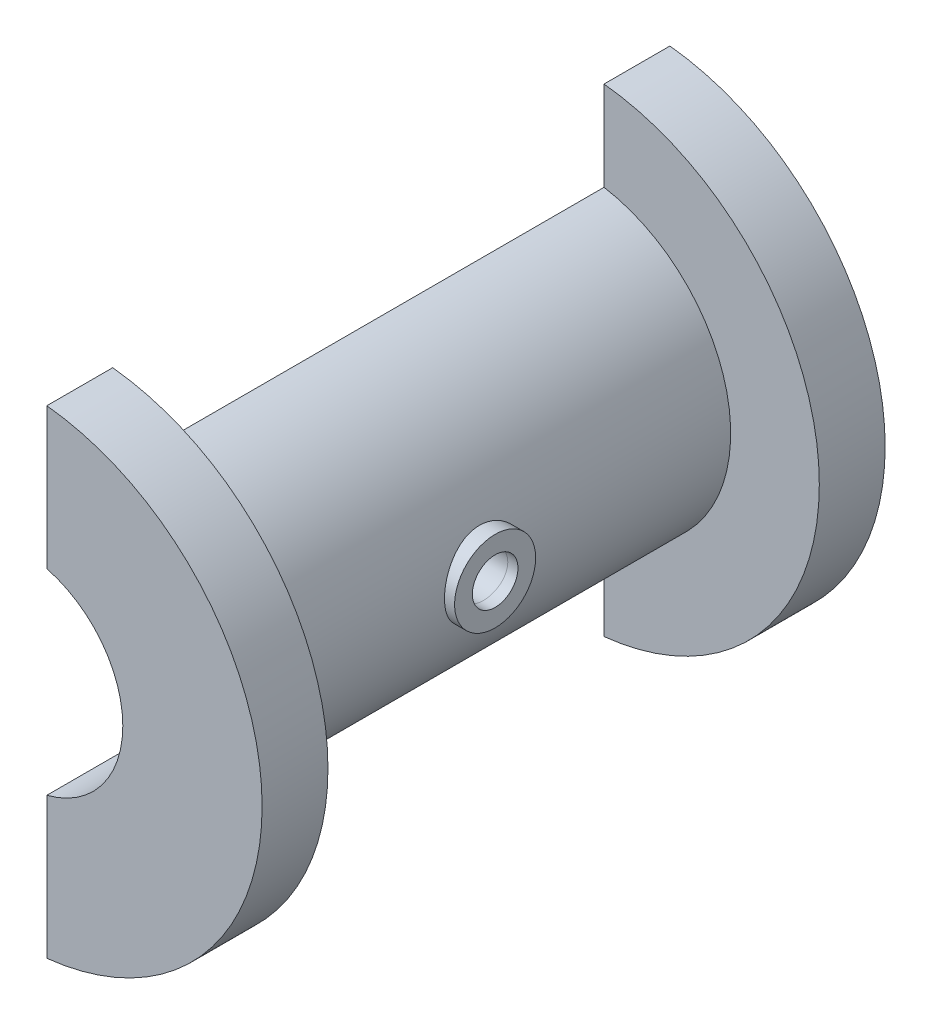
from build123d import *

# Parameters (mm, degrees)
BOSS_EXTRUDE2_DEPTH = 55
BOSS_EXTRUDE5_DEPTH = 6.5
HOLE1_START         = 30.000000107
HOLE1_OUTLINE_R     = 8
HOLE1_OUTLINE_R_2   = 4.5
HOLE1_DEPTH         = 1.999999893
HOLE1_START_2       = 28.913664955
HOLE1_2_OUTLINE_R   = 8
HOLE1_2_OUTLINE_R_2 = 4.5
HOLE1_2_DEPTH       = 1.086335152
HOLE1_START_3       = 5
HOLE1_4_OUTLINE_R   = 4.5
HOLE1_4_DEPTH       = 26


with BuildPart() as part:
    # Sketch2 → Boss-Extrude2 (new, symmetric)
    with BuildSketch(Plane.XY):
        with BuildLine():
            Line((5, 19.364916731), (5, 29.580398915))
            ThreePointArc((5, 29.580398915), (30, 0), (5, -29.580398915))
            Line((5, -29.580398915), (5, -19.364916731))
            ThreePointArc((5, -19.364916731), (20, 0), (5, 19.364916731))
        make_face()
    extrude(amount=BOSS_EXTRUDE2_DEPTH, both=True)

    # Sketch4 → Boss-Extrude5 (add, symmetric)
    with BuildSketch(Plane.XY.offset(55)):
        with BuildLine():
            Line((5, 47.236109069), (5, 29.580398915))
            ThreePointArc((5, 29.580398915), (30, 0), (5, -29.580398915))
            Line((5, -29.580398915), (5, -47.236109069))
            ThreePointArc((5, -47.236109069), (47.5, 0), (5, 47.236109069))
        make_face()
        with BuildLine():
            Line((5, 29.580398915), (5, 19.364916731))
            ThreePointArc((5, 19.364916731), (20, 0), (5, -19.364916731))
            Line((5, -19.364916731), (5, -29.580398915))
            ThreePointArc((5, -29.580398915), (30, 0), (5, 29.580398915))
        make_face()
    extrude(amount=BOSS_EXTRUDE5_DEPTH, both=True)

    # Mirror1: part across plane


with BuildPart() as part_1:
    add(part.part)
    add(part.part.mirror(Plane.XY))

    # Hole1 4 outline → Hole1 4 (cut)
    with BuildSketch(Plane.YZ.offset(HOLE1_START_3)):
        Circle(HOLE1_4_OUTLINE_R)
    extrude(amount=HOLE1_4_DEPTH, mode=Mode.SUBTRACT)


with BuildPart() as body_2:
    # Hole1: read off the stored shape, not the designer's step
    # Hole1 outline → Hole1 (new body)
    with BuildSketch(Plane.YZ.offset(HOLE1_START)):
        Circle(HOLE1_OUTLINE_R)
        Circle(HOLE1_OUTLINE_R_2, mode=Mode.SUBTRACT)
    extrude(amount=HOLE1_DEPTH)

    # Hole1 2 outline → Hole1 2 (add)
    with BuildSketch(Plane.YZ.offset(HOLE1_START_2)):
        Circle(HOLE1_2_OUTLINE_R)
        Circle(HOLE1_2_OUTLINE_R_2, mode=Mode.SUBTRACT)
    extrude(amount=HOLE1_2_DEPTH)

    # Hole1 3: loft between two sections, ruled curve by curve
    hole1_3_from = [
        Edge.make_three_point_arc((28.913509771, 8.000559526, 8.000558771), (30, 6.03e-07, 8.000558771), (28.913510093, -8.000558363, 8.000558771)),
        Edge.make_line((28.913510093, -8.000558363, 8.000558771), (28.913509771, 8.000559526, 8.000558771)),
    ]
    hole1_3_to = [
        Edge.make_three_point_arc((28.913509771, 8.000559526, -8.000001872), (30, 6.03e-07, -8.000001872), (28.913510093, -8.000558363, -8.000001872)),
        Edge.make_line((28.913510093, -8.000558363, -8.000001872), (28.913509771, 8.000559526, -8.000001872)),
    ]
    hole1_3 = Solid(Shell([*[Face.make_surface_from_curves(hole1_3_from[k], hole1_3_to[k]) for k in range(2)], Face(Wire(hole1_3_from)), Face(Wire(hole1_3_to))]))
    add(hole1_3, mode=Mode.SUBTRACT)


solid = Compound([part_1.part, body_2.part])
